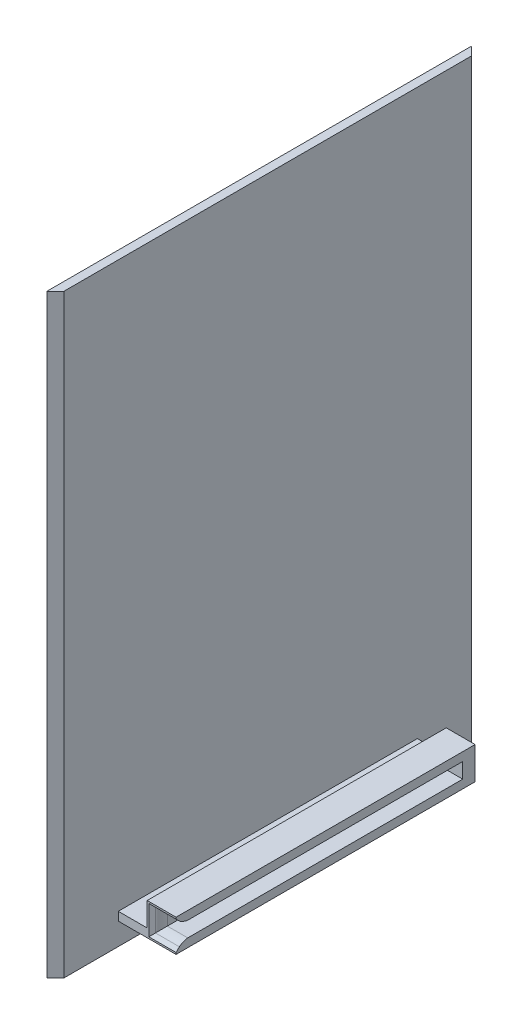
from build123d import *

# Parameters (mm, degrees)
CROQUIS1_W              = 5
CROQUIS1_H              = 250
SALIENTE_EXTRUIR1_DEPTH = 350
CORTAR_EXTRUIR1_REACH   = 432.145
CROQUIS4_W              = 176
CROQUIS4_H              = 5
SALIENTE_EXTRUIR2_DEPTH = 34
CROQUIS5_W              = 5
CROQUIS5_H              = 176
SALIENTE_EXTRUIR3_DEPTH = 9
CROQUIS6_W              = 17
CROQUIS6_H              = 176
SALIENTE_EXTRUIR4_DEPTH = 5
CHAFL_N1_SIZE           = 4
CROQUIS7_W              = 14.582348404
CROQUIS7_H              = 7.3
SALIENTE_EXTRUIR5_DEPTH = 10


with BuildPart() as part:
    # Croquis1 → Saliente-Extruir1 (new body)
    with BuildSketch(Plane(origin=(0, 0, 0), x_dir=(1, 0, 0), z_dir=(0, 1, 0))):
        with Locations((-2.5, 125)):
            Rectangle(CROQUIS1_W, CROQUIS1_H)
    extrude(amount=SALIENTE_EXTRUIR1_DEPTH)

    # Croquis2 → Cortar-Extruir1 (cut, up to next)
    with BuildSketch(Plane(origin=(0, 350, 0), x_dir=(1, 0, 0), z_dir=(0, 1, 0)), mode=Mode.PRIVATE) as cortar_extruir1_sk1:
        Polygon((0, 250), (0, 245), (-5, 250), align=None)
    cortar_extruir1_tool1 = extrude(cortar_extruir1_sk1.sketch, amount=-CORTAR_EXTRUIR1_REACH, mode=Mode.PRIVATE) & part.part
    # Croquis2 → Cortar-Extruir1 (cut, up to next)
    with BuildSketch(Plane(origin=(0, 350, 0), x_dir=(1, 0, 0), z_dir=(0, 1, 0)), mode=Mode.PRIVATE) as cortar_extruir1_sk2:
        Polygon((-5, 0), (0, 5), (0, 0), align=None)
    cortar_extruir1_tool2 = extrude(cortar_extruir1_sk2.sketch, amount=-CORTAR_EXTRUIR1_REACH, mode=Mode.PRIVATE) & part.part
    add(cortar_extruir1_tool1.solids().sort_by_distance((-1.666667, 350, -248.333333))[0], mode=Mode.SUBTRACT)
    add(cortar_extruir1_tool2.solids().sort_by_distance((-1.666667, 350, -1.666667))[0], mode=Mode.SUBTRACT)

    # Croquis4 → Saliente-Extruir2 (add)
    with BuildSketch(Plane(origin=(0, 0, 0), x_dir=(0, 0, -1), z_dir=(1, 0, 0))):
        with Locations((125, 15.5)):
            Rectangle(CROQUIS4_W, CROQUIS4_H)
    extrude(amount=SALIENTE_EXTRUIR2_DEPTH)

    # Croquis5 → Saliente-Extruir3 (add)
    with BuildSketch(Plane(origin=(0, 18, 0), x_dir=(1, 0, 0), z_dir=(0, 1, 0))):
        with Locations((19.5, 125)):
            Rectangle(CROQUIS5_W, CROQUIS5_H)
    extrude(amount=SALIENTE_EXTRUIR3_DEPTH)

    # Croquis6 → Saliente-Extruir4 (add)
    with BuildSketch(Plane(origin=(0, 27, 0), x_dir=(1, 0, 0), z_dir=(0, 1, 0))):
        with Locations((25.5, 125)):
            Rectangle(CROQUIS6_W, CROQUIS6_H)
    extrude(amount=SALIENTE_EXTRUIR4_DEPTH)

    # Chaflán1
    chafl_n1_edges = [part.edges().sort_by_distance(p)[0] for p in [
        (28, 18, -37),
        (22, 22.5, -37),
        (28, 27, -37),
    ]]
    chamfer(chafl_n1_edges, length=CHAFL_N1_SIZE)

    # Redondeo1
    # a fillet whose section is not a circle: 7 mm, written as the material it takes off along each edge
    with BuildSketch(Plane(origin=(14.751262658, 18, -41), x_dir=(0, 0, -1), z_dir=(1, 0, 0))) as redondeo1_piece_1_section:
        with BuildLine():
            Bezier((2.899494937, 0), (0, 0), (-2.050252532, -2.050252532), weights=[1, 0.428571429, 1])
            Line((-2.050252532, -2.050252532), (0, 0))
            Line((0, 0), (2.899494937, 0))
        make_face()
    redondeo1_piece_1 = extrude(amount=26.497474683, mode=Mode.PRIVATE)
    redondeo1_piece_1 = split(redondeo1_piece_1, bisect_by=Plane(origin=(22, 18, -41), z_dir=(-1, 0, 0)), keep=Keep.TOP, mode=Mode.PRIVATE)
    redondeo1_piece_1 = split(redondeo1_piece_1, bisect_by=Plane(origin=(18.375631329, 18, -37.375631329), z_dir=(0.7071067811865476, 0, 0.7071067811865476)), keep=Keep.TOP, mode=Mode.PRIVATE)
    add(redondeo1_piece_1, mode=Mode.SUBTRACT)
    with BuildSketch(Plane(origin=(22, 18, -41), x_dir=(0, 0, -1), z_dir=(1, 0, 0))) as redondeo1_piece_2_section:
        with BuildLine():
            Bezier((2.899494937, 0), (0, 0), (-2.050252532, -2.050252532), weights=[1, 0.428571429, 1])
            Line((-2.050252532, -2.050252532), (0, 0))
            Line((0, 0), (2.899494937, 0))
        make_face()
    redondeo1_piece_2 = extrude(amount=19.248737342, mode=Mode.PRIVATE)
    redondeo1_piece_2 = split(redondeo1_piece_2, bisect_by=Plane(origin=(22, 18, -41), z_dir=(-0.7071067811865476, 0, -0.7071067811865476)), keep=Keep.TOP, mode=Mode.PRIVATE)
    add(redondeo1_piece_2, mode=Mode.SUBTRACT)
    with BuildSketch(Plane(origin=(22, 18, -41), x_dir=(0, 0, -1), z_dir=(1, 0, 0))) as redondeo1_piece_3_section:
        with BuildLine():
            Bezier((2.899494937, 0), (0, 0), (-2.050252532, -2.050252532), weights=[1, 0.428571429, 1])
            Line((-2.050252532, -2.050252532), (0, 0))
            Line((0, 0), (2.899494937, 0))
        make_face()
    redondeo1_piece_3 = extrude(amount=19.248737342, mode=Mode.PRIVATE)
    redondeo1_piece_3 = split(redondeo1_piece_3, bisect_by=Plane(origin=(22, 18, -41), z_dir=(0.7071067811865476, 0, 0.7071067811865476)), keep=Keep.TOP, mode=Mode.PRIVATE)
    add(redondeo1_piece_3, mode=Mode.SUBTRACT)
    with BuildSketch(Plane(origin=(22, 10.751262658, -41), x_dir=(0, 0, -1), z_dir=(0, 1, 0))) as redondeo1_piece_4_section:
        with BuildLine():
            Bezier((2.899494937, 0), (0, 0), (-2.050252532, 2.050252532), weights=[1, 0.428571429, 1])
            Line((-2.050252532, 2.050252532), (0, 0))
            Line((0, 0), (2.899494937, 0))
        make_face()
    redondeo1_piece_4 = extrude(amount=16.248737342, mode=Mode.PRIVATE)
    redondeo1_piece_4 = split(redondeo1_piece_4, bisect_by=Plane(origin=(22, 18, -41), z_dir=(0, -1, 0)), keep=Keep.TOP, mode=Mode.PRIVATE)
    redondeo1_piece_4 = split(redondeo1_piece_4, bisect_by=Plane(origin=(22, 14.375631329, -37.375631329), z_dir=(0, 0.7071067811865476, 0.7071067811865476)), keep=Keep.TOP, mode=Mode.PRIVATE)
    add(redondeo1_piece_4, mode=Mode.SUBTRACT)
    with BuildSketch(Plane(origin=(22, 18, -41), x_dir=(0, 0, -1), z_dir=(0, 1, 0))) as redondeo1_piece_5_section:
        with BuildLine():
            Bezier((2.899494937, 0), (0, 0), (-2.050252532, 2.050252532), weights=[1, 0.428571429, 1])
            Line((-2.050252532, 2.050252532), (0, 0))
            Line((0, 0), (2.899494937, 0))
        make_face()
    redondeo1_piece_5 = extrude(amount=9, mode=Mode.PRIVATE)
    redondeo1_piece_5 = split(redondeo1_piece_5, bisect_by=Plane(origin=(22, 18, -41), z_dir=(0, -0.7071067811865476, -0.7071067811865476)), keep=Keep.TOP, mode=Mode.PRIVATE)
    add(redondeo1_piece_5, mode=Mode.SUBTRACT)
    with BuildSketch(Plane(origin=(22, 18, -41), x_dir=(0, 0, -1), z_dir=(0, 1, 0))) as redondeo1_piece_6_section:
        with BuildLine():
            Bezier((2.899494937, 0), (0, 0), (-2.050252532, 2.050252532), weights=[1, 0.428571429, 1])
            Line((-2.050252532, 2.050252532), (0, 0))
            Line((0, 0), (2.899494937, 0))
        make_face()
    redondeo1_piece_6 = extrude(amount=9, mode=Mode.PRIVATE)
    redondeo1_piece_6 = split(redondeo1_piece_6, bisect_by=Plane(origin=(22, 18, -41), z_dir=(0, 0.7071067811865476, 0.7071067811865476)), keep=Keep.TOP, mode=Mode.PRIVATE)
    redondeo1_piece_6 = split(redondeo1_piece_6, bisect_by=Plane(origin=(22, 22.5, -45.5), z_dir=(0, -0.7071067811865476, 0.7071067811865476)), keep=Keep.TOP, mode=Mode.PRIVATE)
    add(redondeo1_piece_6, mode=Mode.SUBTRACT)
    with BuildSketch(Plane(origin=(22, 18, -41), x_dir=(0, 0, -1), z_dir=(0, 1, 0))) as redondeo1_piece_7_section:
        with BuildLine():
            Bezier((2.899494937, 0), (0, 0), (-2.050252532, 2.050252532), weights=[1, 0.428571429, 1])
            Line((-2.050252532, 2.050252532), (0, 0))
            Line((0, 0), (2.899494937, 0))
        make_face()
    redondeo1_piece_7 = extrude(amount=16.248737342, mode=Mode.PRIVATE)
    redondeo1_piece_7 = split(redondeo1_piece_7, bisect_by=Plane(origin=(22, 27, -41), z_dir=(0, 1, 0)), keep=Keep.TOP, mode=Mode.PRIVATE)
    redondeo1_piece_7 = split(redondeo1_piece_7, bisect_by=Plane(origin=(22, 22.5, -45.5), z_dir=(0, -0.7071067811865476, 0.7071067811865476)), keep=Keep.TOP, mode=Mode.PRIVATE)
    add(redondeo1_piece_7, mode=Mode.SUBTRACT)
    with BuildSketch(Plane(origin=(22, 18, -41), x_dir=(0, 0, -1), z_dir=(0, 1, 0))) as redondeo1_piece_8_section:
        with BuildLine():
            Bezier((2.899494937, 0), (0, 0), (-2.050252532, 2.050252532), weights=[1, 0.428571429, 1])
            Line((-2.050252532, 2.050252532), (0, 0))
            Line((0, 0), (2.899494937, 0))
        make_face()
    redondeo1_piece_8 = extrude(amount=9, mode=Mode.PRIVATE)
    redondeo1_piece_8 = split(redondeo1_piece_8, bisect_by=Plane(origin=(22, 22.5, -45.5), z_dir=(0, 0.7071067811865476, -0.7071067811865476)), keep=Keep.TOP, mode=Mode.PRIVATE)
    add(redondeo1_piece_8, mode=Mode.SUBTRACT)
    with BuildSketch(Plane(origin=(41.248737342, 27, -41), x_dir=(0, 0, -1), z_dir=(-1, 0, 0))) as redondeo1_piece_9_section:
        with BuildLine():
            Bezier((2.899494937, 0), (0, 0), (-2.050252532, -2.050252532), weights=[1, 0.428571429, 1])
            Line((-2.050252532, -2.050252532), (0, 0))
            Line((0, 0), (2.899494937, 0))
        make_face()
    redondeo1_piece_9 = extrude(amount=19.248737342, mode=Mode.PRIVATE)
    redondeo1_piece_9 = split(redondeo1_piece_9, bisect_by=Plane(origin=(31.624368671, 27, -50.624368671), z_dir=(0.7071067811865476, 0, 0.7071067811865476)), keep=Keep.TOP, mode=Mode.PRIVATE)
    add(redondeo1_piece_9, mode=Mode.SUBTRACT)
    with BuildSketch(Plane(origin=(41.248737342, 27, -41), x_dir=(0, 0, -1), z_dir=(-1, 0, 0))) as redondeo1_piece_10_section:
        with BuildLine():
            Bezier((2.899494937, 0), (0, 0), (-2.050252532, -2.050252532), weights=[1, 0.428571429, 1])
            Line((-2.050252532, -2.050252532), (0, 0))
            Line((0, 0), (2.899494937, 0))
        make_face()
    redondeo1_piece_10 = extrude(amount=26.497474683, mode=Mode.PRIVATE)
    redondeo1_piece_10 = split(redondeo1_piece_10, bisect_by=Plane(origin=(22, 27, -41), z_dir=(-1, 0, 0)), keep=Keep.TOP, mode=Mode.PRIVATE)
    redondeo1_piece_10 = split(redondeo1_piece_10, bisect_by=Plane(origin=(31.624368671, 27, -50.624368671), z_dir=(0.7071067811865476, 0, 0.7071067811865476)), keep=Keep.TOP, mode=Mode.PRIVATE)
    add(redondeo1_piece_10, mode=Mode.SUBTRACT)
    with BuildSketch(Plane(origin=(41.248737342, 27, -41), x_dir=(0, 0, -1), z_dir=(-1, 0, 0))) as redondeo1_piece_11_section:
        with BuildLine():
            Bezier((2.899494937, 0), (0, 0), (-2.050252532, -2.050252532), weights=[1, 0.428571429, 1])
            Line((-2.050252532, -2.050252532), (0, 0))
            Line((0, 0), (2.899494937, 0))
        make_face()
    redondeo1_piece_11 = extrude(amount=19.248737342, mode=Mode.PRIVATE)
    redondeo1_piece_11 = split(redondeo1_piece_11, bisect_by=Plane(origin=(31.624368671, 27, -50.624368671), z_dir=(-0.7071067811865476, 0, -0.7071067811865476)), keep=Keep.TOP, mode=Mode.PRIVATE)
    add(redondeo1_piece_11, mode=Mode.SUBTRACT)
    with BuildSketch(Plane(origin=(14.751262658, 18, -41), x_dir=(0, 0, -1), z_dir=(1, 0, 0))) as redondeo1_piece_12a_section:
        with BuildLine():
            Bezier((2.899494937, 0), (0, 0), (-2.050252532, -2.050252532), weights=[1, 0.428571429, 1])
            Line((-2.050252532, -2.050252532), (0, 0))
            Line((0, 0), (2.899494937, 0))
        make_face()
    redondeo1_piece_12a = extrude(amount=26.497474683, mode=Mode.PRIVATE)
    redondeo1_piece_12a = split(redondeo1_piece_12a, bisect_by=Plane(origin=(22, 18, -41), z_dir=(-1, 0, 0)), keep=Keep.TOP, mode=Mode.PRIVATE)
    redondeo1_piece_12a = split(redondeo1_piece_12a, bisect_by=Plane(origin=(18.375631329, 18, -37.375631329), z_dir=(-0.7071067811865476, 0, -0.7071067811865476)), keep=Keep.TOP, mode=Mode.PRIVATE)
    redondeo1_piece_12a = split(redondeo1_piece_12a, bisect_by=Plane(origin=(17, 18, -41), z_dir=(1, 0, 0)), keep=Keep.TOP, mode=Mode.PRIVATE)
    with BuildSketch(Plane(origin=(22, 10.751262658, -41), x_dir=(0, 0, -1), z_dir=(0, 1, 0))) as redondeo1_piece_12b_section:
        with BuildLine():
            Bezier((2.899494937, 0), (0, 0), (-2.050252532, 2.050252532), weights=[1, 0.428571429, 1])
            Line((-2.050252532, 2.050252532), (0, 0))
            Line((0, 0), (2.899494937, 0))
        make_face()
    redondeo1_piece_12b = extrude(amount=16.248737342, mode=Mode.PRIVATE)
    redondeo1_piece_12b = split(redondeo1_piece_12b, bisect_by=Plane(origin=(22, 18, -41), z_dir=(0, -1, 0)), keep=Keep.TOP, mode=Mode.PRIVATE)
    redondeo1_piece_12b = split(redondeo1_piece_12b, bisect_by=Plane(origin=(22, 14.375631329, -37.375631329), z_dir=(0, -0.7071067811865476, -0.7071067811865476)), keep=Keep.TOP, mode=Mode.PRIVATE)
    redondeo1_piece_12 = redondeo1_piece_12a & redondeo1_piece_12b
    add(redondeo1_piece_12, mode=Mode.SUBTRACT)
    with BuildSketch(Plane(origin=(22, 18, -41), x_dir=(0, 0, -1), z_dir=(0, 1, 0))) as redondeo1_piece_13a_section:
        with BuildLine():
            Bezier((2.899494937, 0), (0, 0), (-2.050252532, 2.050252532), weights=[1, 0.428571429, 1])
            Line((-2.050252532, 2.050252532), (0, 0))
            Line((0, 0), (2.899494937, 0))
        make_face()
    redondeo1_piece_13a = extrude(amount=16.248737342, mode=Mode.PRIVATE)
    redondeo1_piece_13a = split(redondeo1_piece_13a, bisect_by=Plane(origin=(22, 27, -41), z_dir=(0, 1, 0)), keep=Keep.TOP, mode=Mode.PRIVATE)
    redondeo1_piece_13a = split(redondeo1_piece_13a, bisect_by=Plane(origin=(22, 22.5, -45.5), z_dir=(0, 0.7071067811865476, -0.7071067811865476)), keep=Keep.TOP, mode=Mode.PRIVATE)
    with BuildSketch(Plane(origin=(41.248737342, 27, -41), x_dir=(0, 0, -1), z_dir=(-1, 0, 0))) as redondeo1_piece_13b_section:
        with BuildLine():
            Bezier((2.899494937, 0), (0, 0), (-2.050252532, -2.050252532), weights=[1, 0.428571429, 1])
            Line((-2.050252532, -2.050252532), (0, 0))
            Line((0, 0), (2.899494937, 0))
        make_face()
    redondeo1_piece_13b = extrude(amount=26.497474683, mode=Mode.PRIVATE)
    redondeo1_piece_13b = split(redondeo1_piece_13b, bisect_by=Plane(origin=(22, 27, -41), z_dir=(-1, 0, 0)), keep=Keep.TOP, mode=Mode.PRIVATE)
    redondeo1_piece_13b = split(redondeo1_piece_13b, bisect_by=Plane(origin=(31.624368671, 27, -50.624368671), z_dir=(-0.7071067811865476, 0, -0.7071067811865476)), keep=Keep.TOP, mode=Mode.PRIVATE)
    redondeo1_piece_13 = redondeo1_piece_13a & redondeo1_piece_13b
    add(redondeo1_piece_13, mode=Mode.SUBTRACT)

    # Croquis7 → Saliente-Extruir5 (add)
    with BuildSketch(Plane(origin=(0, 18, 0), x_dir=(1, 0, 0), z_dir=(0, 1, 0))):
        with Locations((26.708825798, 209.35)):
            Rectangle(CROQUIS7_W, CROQUIS7_H)
    extrude(amount=SALIENTE_EXTRUIR5_DEPTH)


solid = part.part
